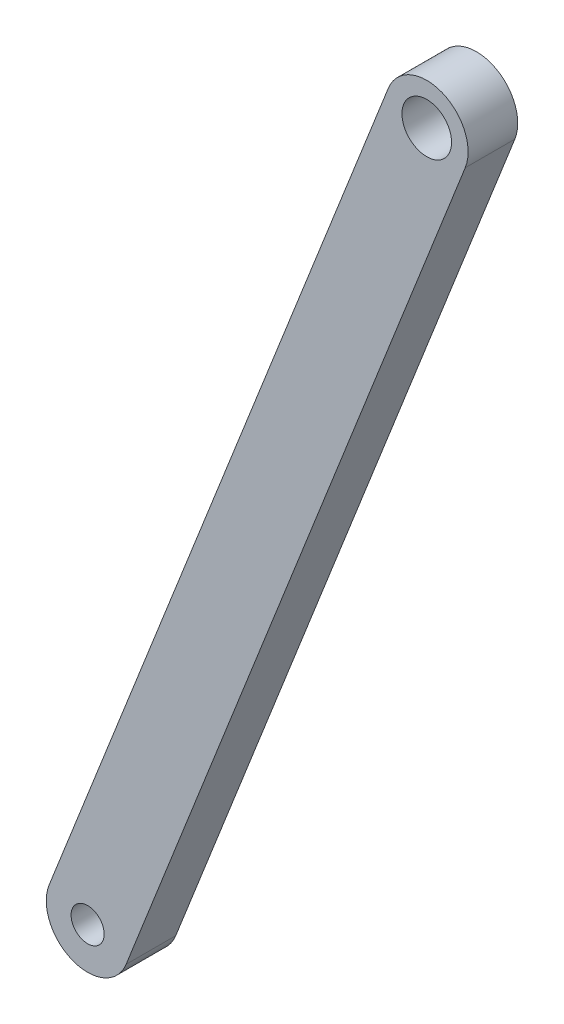
from build123d import *

# Parameters (mm, degrees)
AUFSATZ_LINEAR_AUSTRAGEN1_DEPTH      = 3
AUFSATZ_LINEAR_AUSTRAGEN1_DEPTH_BACK = 3
SKIZZE3_R                            = 3
SKIZZE3_R_2                          = 2


with BuildPart() as part:
    # Skizze3 → Aufsatz-Linear austragen1 (new, two sides: drawn at the far end of the back side and taken through both)
    with BuildSketch(Plane.XY.offset(-AUFSATZ_LINEAR_AUSTRAGEN1_DEPTH_BACK)):
        with BuildLine():
            Line((24.349022765, 577.935323067), (65.349022765, 681.835323067))
            ThreePointArc((65.349022765, 681.835323067), (71.835323067, 684.650977235), (74.650977235, 678.164676933))
            Line((74.650977235, 678.164676933), (33.650977235, 574.264676933))
            ThreePointArc((33.650977235, 574.264676933), (27.164676933, 571.449022765), (24.349022765, 577.935323067))
        make_face()
        with Locations((70, 680)):
            Circle(SKIZZE3_R, mode=Mode.SUBTRACT)
        with Locations((29, 576.1)):
            Circle(SKIZZE3_R_2, mode=Mode.SUBTRACT)
    extrude(amount=AUFSATZ_LINEAR_AUSTRAGEN1_DEPTH + AUFSATZ_LINEAR_AUSTRAGEN1_DEPTH_BACK)


solid = part.part
